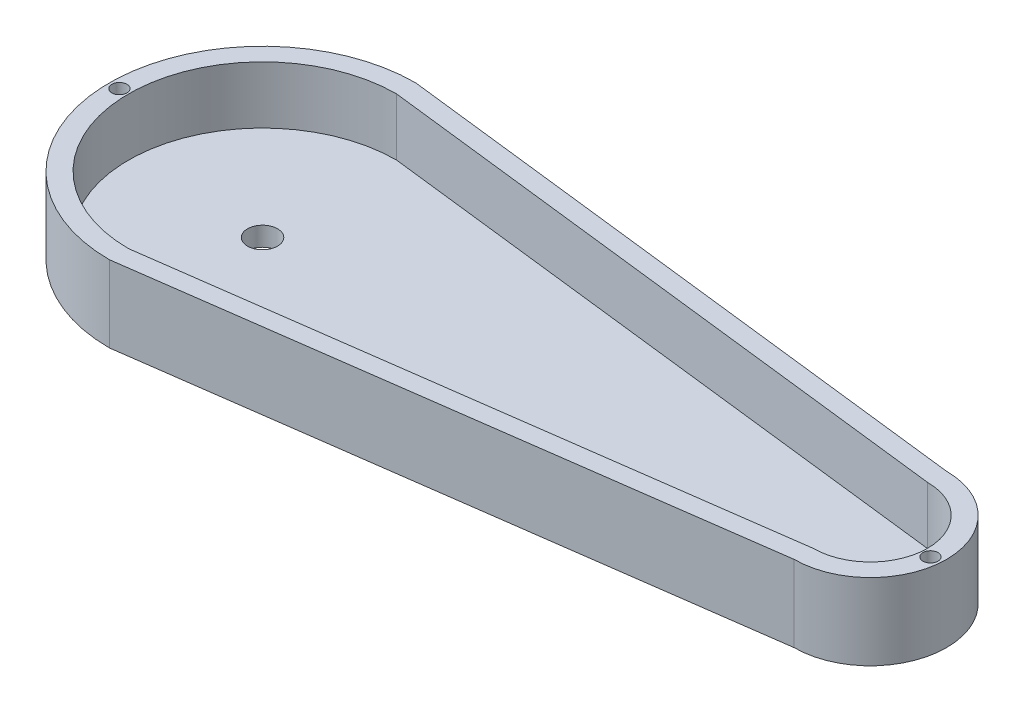
from build123d import *

# Parameters (mm, degrees)
BOSS_EXTRUDE1_DEPTH = 25.4
CUT_EXTRUDE1_DEPTH  = 19.05
SKETCH3_R           = 2.5
CUT_EXTRUDE2_DEPTH  = 25.4
SKETCH6_R           = 5
CUT_EXTRUDE3_DEPTH  = 6.35
SKETCH5_R           = 5
CUT_EXTRUDE4_DEPTH  = 6.35


with BuildPart() as part:
    # Sketch1 → Boss-Extrude1 (new body)
    with BuildSketch(Plane(origin=(0, 0, 0), x_dir=(1, 0, 0), z_dir=(0, 1, 0))):
        with BuildLine():
            Line((0, 50.892363224), (200.000108, 27.30276997))
            ThreePointArc((200.000108, 27.30276997), (225.337078532, 1.965799438), (200.000108, -23.371171094))
            Line((200.000108, -23.371171094), (0, -50.892363224))
            ThreePointArc((0, -50.892363224), (-50.892363224, 0), (0, 50.892363224))
        make_face()
    extrude(amount=BOSS_EXTRUDE1_DEPTH)

    # Sketch2 → Cut-Extrude1 (cut)
    with BuildSketch(Plane(origin=(0, 25.4, 0), x_dir=(1, 0, 0), z_dir=(0, 1, 0))):
        with BuildLine():
            Line((0, 44.531838188), (200.000108, 20.958478183))
            ThreePointArc((200.000108, 20.958478183), (218.992786745, 1.965799438), (200.000108, -17.026879307))
            Line((200.000108, -17.026879307), (0, -44.531838188))
            ThreePointArc((0, -44.531838188), (-44.531838188, 0), (0, 44.531838188))
        make_face()
    extrude(amount=-CUT_EXTRUDE1_DEPTH, mode=Mode.SUBTRACT)

    # Sketch3 → Cut-Extrude2 (cut)
    with BuildSketch(Plane(origin=(0, 25.4, 0), x_dir=(1, 0, 0), z_dir=(0, 1, 0))):
        with Locations((-47.56908022, 0)):
            Circle(SKETCH3_R)
        with Locations((221.926143204, 0)):
            Circle(SKETCH3_R)
    extrude(amount=-CUT_EXTRUDE2_DEPTH, mode=Mode.SUBTRACT)

    # Sketch6 → Cut-Extrude3 (cut)
    with BuildSketch(Plane(origin=(0, 6.35, 0), x_dir=(1, 0, 0), z_dir=(0, 1, 0))):
        with Locations((200.000108, 0)):
            Circle(SKETCH6_R)
    extrude(amount=-CUT_EXTRUDE3_DEPTH, mode=Mode.SUBTRACT)

    # Sketch5 → Cut-Extrude4 (cut)
    with BuildSketch(Plane(origin=(0, 6.35, 0), x_dir=(1, 0, 0), z_dir=(0, 1, 0))):
        Circle(SKETCH5_R)
    extrude(amount=-CUT_EXTRUDE4_DEPTH, mode=Mode.SUBTRACT)


solid = part.part
